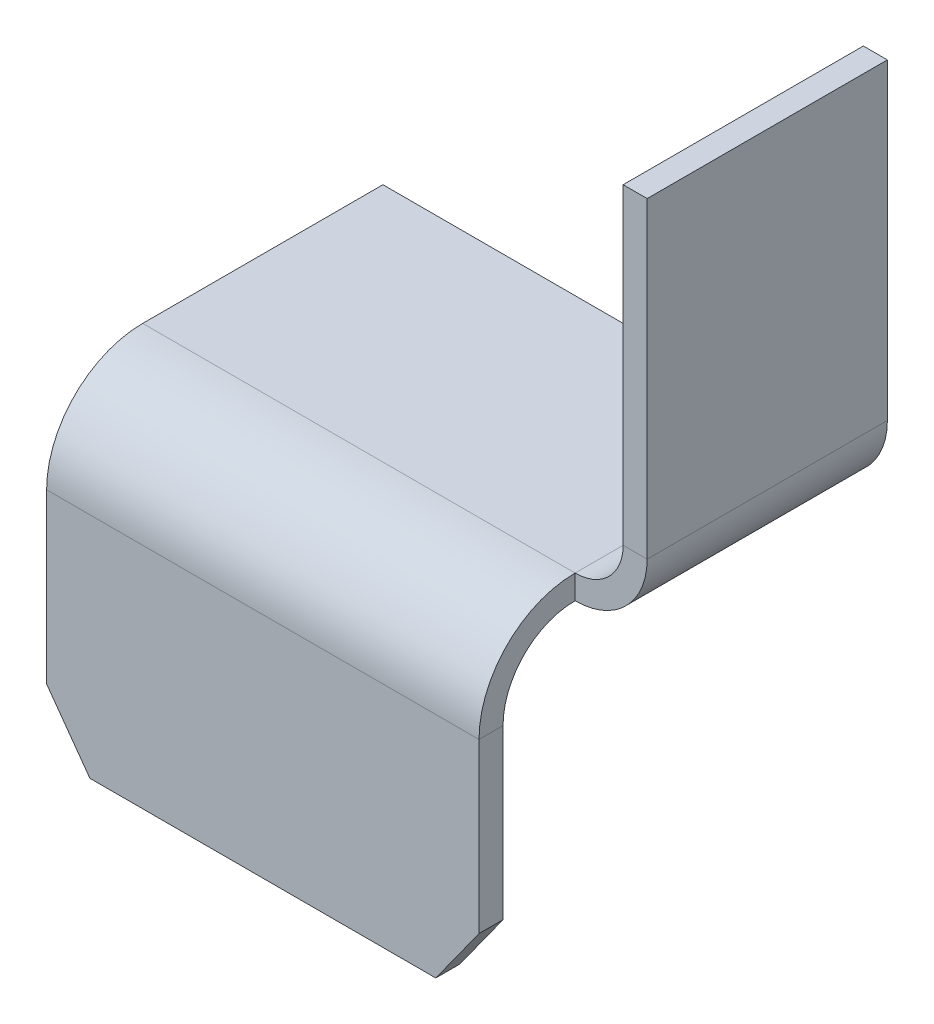
from build123d import *

# Parameters (mm, degrees)
SM_BASE_FLANGE_1_DEPTH      = 10
SM_EDGE_FLANGE_2_DEPTH      = 18
SM_START                    = 1
SM_EDGE_FLANGE_2_FLAT_DEPTH = 1


# Sheet-metal steps are written as plain solids
with BuildPart() as part:
    # Sketch 1 → 基体-法兰1 (new body)
    with BuildSketch(Plane.XY):
        with BuildLine():
            Line((0, 0), (18, 0))
            ThreePointArc((18, 0), (19.414213562, 0.585786438), (20, 2))
            Line((20, 2), (20, 15))
            Line((20, 15), (21, 15))
            Line((21, 15), (21, 2))
            ThreePointArc((21, 2), (20.121320344, -0.121320344), (18, -1))
            Line((18, -1), (0, -1))
            Line((0, -1), (0, 0))
        make_face()
    extrude(amount=SM_BASE_FLANGE_1_DEPTH)

    # 边线-法兰2 bend section (across the edge) → 边线-法兰2 (add)
    with BuildSketch(Plane(origin=(18, -1, 13), x_dir=(0, 0, -1), z_dir=(-1, 0, 0))):
        with BuildLine():
            Line((-1, 3), (0, 3))
            ThreePointArc((0, 3), (0.878679656, 0.878679656), (3, 0))
            Line((3, 0), (3, -1))
            ThreePointArc((3, -1), (0.171572875, 0.171572875), (-1, 3))
        make_face()
    extrude(amount=SM_EDGE_FLANGE_2_DEPTH)

    # 边线-法兰2 profile (on flange) → 边线-法兰2 flat (add)
    with BuildSketch(Plane(origin=(0, -1, 13), x_dir=(-1, 0, 0), z_dir=(0, 0, 1)).offset(SM_START)):
        Polygon((0, 3), (0, 10), (-1.8, 12.5), (-16.2, 12.5), (-18, 10), (-18, 3), align=None)
    extrude(amount=-SM_EDGE_FLANGE_2_FLAT_DEPTH)


solid = part.part
